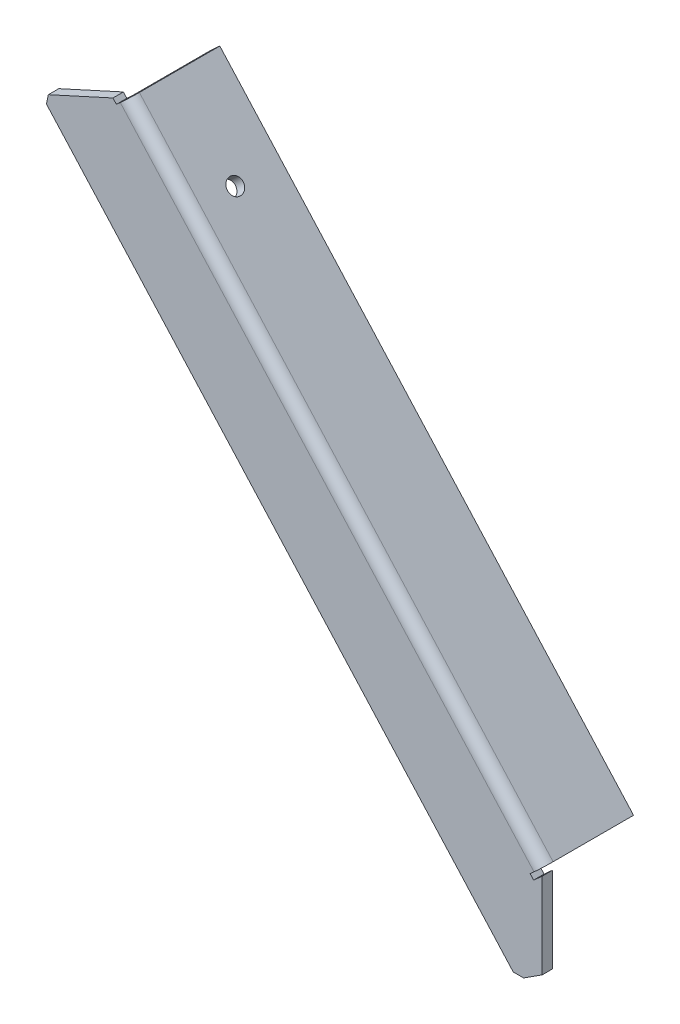
from build123d import *

# Parameters (mm, degrees)
BASE_FLANGE1_DEPTH            = 4
EDGE_FLANGE1_STRIP_W          = 16.4
EDGE_FLANGE1_STRIP_H          = 4
EDGE_FLANGE1_STRIP_CUT_DEPTH  = 236.766242904
EDGE_FLANGE1_RELIEF_W         = 18.4
EDGE_FLANGE1_RELIEF_H         = 2
EDGE_FLANGE1_RELIEF_CUT_DEPTH = 4
EDGE_FLANGE1_DEPTH            = 236.766242904
SKETCH9_R                     = 3
CUT_EXTRUDE1_DEPTH            = 10


# Sheet-metal steps are written as plain solids
with BuildPart() as part:
    # Sketch1 → Base-Flange1 (new body)
    with BuildSketch(Plane.XY):
        Polygon((0, 22.5), (-158.455818563, 198.426141726), (-189.121858967, 184.45082196), (-189.843992647, 180.977630435), (-11.076158097, -17.5), (-7.076158097, -17.5), (0, -12.935441332), align=None)
    extrude(amount=-BASE_FLANGE1_DEPTH)

    # Edge-Flange1 strip (across the edge) → Edge-Flange1 strip cut (cut)
    with BuildSketch(Plane(origin=(-158.455818563, 198.426141726, -4), x_dir=(-0.7430372656499554, -0.6692500443447409, -3.4914813388431334e-15), z_dir=(0.6692500443447409, -0.7430372656499554, 0))):
        with Locations((-4, -2)):
            Rectangle(EDGE_FLANGE1_STRIP_W, EDGE_FLANGE1_STRIP_H)
    extrude(amount=EDGE_FLANGE1_STRIP_CUT_DEPTH, mode=Mode.SUBTRACT)

    # Edge-Flange1 relief (on the sheet) → Edge-Flange1 relief cut (cut)
    with BuildSketch(Plane(origin=(-161.576575079, 195.615291539, -4), x_dir=(-0.7430372656499554, -0.6692500443447409, -6.982962677686267e-15), z_dir=(0, 0, -1))):
        with Locations((-7.2, 1)):
            Rectangle(EDGE_FLANGE1_RELIEF_W, EDGE_FLANGE1_RELIEF_H)
        with Locations((-7.2, -237.766242904)):
            Rectangle(EDGE_FLANGE1_RELIEF_W, EDGE_FLANGE1_RELIEF_H)
    extrude(amount=-EDGE_FLANGE1_RELIEF_CUT_DEPTH, mode=Mode.SUBTRACT)

    # Edge-Flange1 section (across the edge) → Edge-Flange1 (add)
    with BuildSketch(Plane(origin=(-158.455818563, 198.426141726, -4), x_dir=(-0.7430372656499554, -0.6692500443447409, -3.4914813388431334e-15), z_dir=(0.6692500443447409, -0.7430372656499554, 0))):
        with BuildLine():
            Line((0, 0.2), (0, 31))
            Line((0, 31), (4, 31))
            Line((4, 31), (4, 0.2))
            ThreePointArc((4, 0.2), (4.058578644, 0.058578644), (4.2, 0))
            Line((4.2, 0), (4.2, -4))
            ThreePointArc((4.2, -4), (1.230151519, -2.769848481), (0, 0.2))
        make_face()
    extrude(amount=EDGE_FLANGE1_DEPTH)

    # Sketch9 → Cut-Extrude1 (cut)
    with BuildSketch(Plane(origin=(11.188748767, 10.077651492, 0), x_dir=(0, 0, -1), z_dir=(0.7430372656499554, 0.6692500443447409, -3.560476072298782e-15))):
        with Locations(Location((17.5, 218.484581381, 0), (0, 0, 90))):
            Circle(SKETCH9_R)
    extrude(amount=-CUT_EXTRUDE1_DEPTH, mode=Mode.SUBTRACT)


solid = part.part
